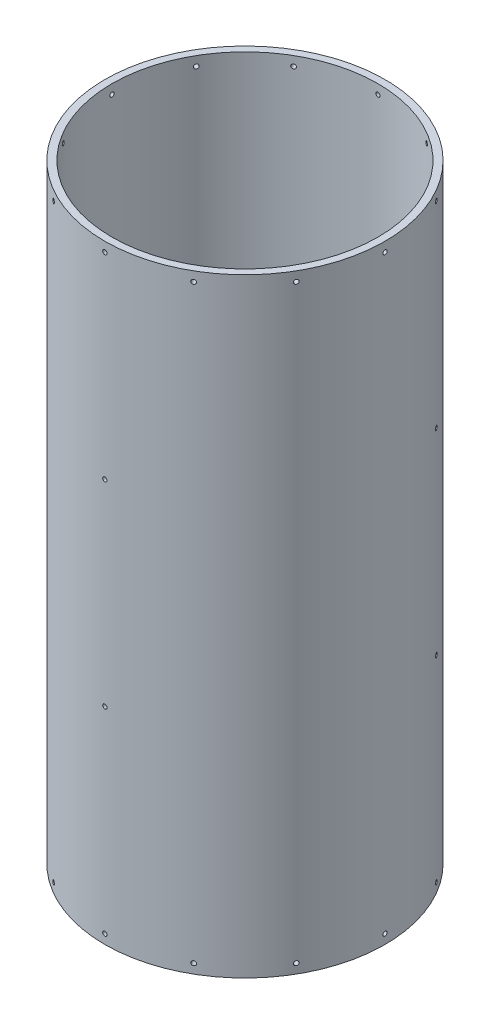
from build123d import *

# Parameters (mm, degrees)
SKETCH1_R                = 93.6625
SKETCH1_R_2              = 88.9
BOSS_EXTRUDE1_DEPTH      = 203.581
SKETCH3_R                = 1.4351
CUT_EXTRUDE1_DEPTH       = 19.304
CIRPATTERN1_COUNT        = 12
MIRROR1_COPY_1_SKETCH_R  = 1.4351
MIRROR1_COPY_1_DEPTH     = 19.304
MIRROR1_COPY_2_SKETCH_R  = 1.4351
MIRROR1_COPY_2_DEPTH     = 19.304
MIRROR1_COPY_3_SKETCH_R  = 1.4351
MIRROR1_COPY_3_DEPTH     = 19.304
MIRROR1_COPY_4_SKETCH_R  = 1.4351
MIRROR1_COPY_4_DEPTH     = 19.304
MIRROR1_COPY_5_SKETCH_R  = 1.4351
MIRROR1_COPY_5_DEPTH     = 19.304
MIRROR1_COPY_6_SKETCH_R  = 1.4351
MIRROR1_COPY_6_DEPTH     = 19.304
MIRROR1_COPY_7_SKETCH_R  = 1.4351
MIRROR1_COPY_7_DEPTH     = 19.304
MIRROR1_COPY_8_SKETCH_R  = 1.4351
MIRROR1_COPY_8_DEPTH     = 19.304
MIRROR1_COPY_9_SKETCH_R  = 1.4351
MIRROR1_COPY_9_DEPTH     = 19.304
MIRROR1_COPY_10_SKETCH_R = 1.4351
MIRROR1_COPY_10_DEPTH    = 19.304
MIRROR1_COPY_11_SKETCH_R = 1.4351
MIRROR1_COPY_11_DEPTH    = 19.304
SKETCH4_R                = 1.4351
CUT_EXTRUDE2_DEPTH       = 43.18
CIRPATTERN2_COUNT        = 3


with BuildPart() as part:
    # Sketch1 → Boss-Extrude1 (new, symmetric)
    with BuildSketch(Plane(origin=(0, 0, 0), x_dir=(1, 0, 0), z_dir=(0, 1, 0))):
        Circle(SKETCH1_R)
        Circle(SKETCH1_R_2, mode=Mode.SUBTRACT)
    extrude(amount=BOSS_EXTRUDE1_DEPTH, both=True)

    # Sketch3 → Cut-Extrude1 (cut)
    with BuildSketch(Plane.XY.offset(93.6625)):
        with Locations((0, -197.231)):
            Circle(SKETCH3_R)
    cut_extrude1 = extrude(amount=-CUT_EXTRUDE1_DEPTH, mode=Mode.SUBTRACT)

    # CirPattern1: Cut-Extrude1 ×12 about axis
    cirpattern1_axis = Axis((0, 203.581, 0), (0, -1, 0))
    for i in range(1, CIRPATTERN1_COUNT):
        add(cut_extrude1.rotate(cirpattern1_axis, i * 360 / CIRPATTERN1_COUNT), mode=Mode.SUBTRACT)

    # Mirror1: Cut-Extrude1 across plane
    add(cut_extrude1.mirror(Plane.ZX), mode=Mode.SUBTRACT)

    # Mirror1 copy 1 sketch → Mirror1 copy 1 (cut)
    with BuildSketch(Plane(origin=(-46.83125, 0, 81.114104382), x_dir=(0.8660254037844387, 0, 0.49999999999999994), z_dir=(-0.49999999999999994, 0, 0.8660254037844387))):
        with Locations((0, 197.231)):
            Circle(MIRROR1_COPY_1_SKETCH_R)
    extrude(amount=-MIRROR1_COPY_1_DEPTH, mode=Mode.SUBTRACT)

    # Mirror1 copy 2 sketch → Mirror1 copy 2 (cut)
    with BuildSketch(Plane(origin=(-81.114104382, 0, 46.83125), x_dir=(0.5000000000000001, 0, 0.8660254037844386), z_dir=(-0.8660254037844386, 0, 0.5000000000000001))):
        with Locations((0, 197.231)):
            Circle(MIRROR1_COPY_2_SKETCH_R)
    extrude(amount=-MIRROR1_COPY_2_DEPTH, mode=Mode.SUBTRACT)

    # Mirror1 copy 3 sketch → Mirror1 copy 3 (cut)
    with BuildSketch(Plane.ZY.offset(93.6625)):
        with Locations((0, 197.231)):
            Circle(MIRROR1_COPY_3_SKETCH_R)
    extrude(amount=-MIRROR1_COPY_3_DEPTH, mode=Mode.SUBTRACT)

    # Mirror1 copy 4 sketch → Mirror1 copy 4 (cut)
    with BuildSketch(Plane(origin=(-81.114104382, 0, -46.83125), x_dir=(-0.4999999999999998, 0, 0.8660254037844387), z_dir=(-0.8660254037844387, 0, -0.4999999999999998))):
        with Locations((0, 197.231)):
            Circle(MIRROR1_COPY_4_SKETCH_R)
    extrude(amount=-MIRROR1_COPY_4_DEPTH, mode=Mode.SUBTRACT)

    # Mirror1 copy 5 sketch → Mirror1 copy 5 (cut)
    with BuildSketch(Plane(origin=(-46.83125, 0, -81.114104382), x_dir=(-0.8660254037844387, 0, 0.49999999999999994), z_dir=(-0.49999999999999994, 0, -0.8660254037844387))):
        with Locations((0, 197.231)):
            Circle(MIRROR1_COPY_5_SKETCH_R)
    extrude(amount=-MIRROR1_COPY_5_DEPTH, mode=Mode.SUBTRACT)

    # Mirror1 copy 6 sketch → Mirror1 copy 6 (cut)
    with BuildSketch(Plane(origin=(0, 0, -93.6625), x_dir=(-1, 0, 0), z_dir=(0, 0, -1))):
        with Locations((0, 197.231)):
            Circle(MIRROR1_COPY_6_SKETCH_R)
    extrude(amount=-MIRROR1_COPY_6_DEPTH, mode=Mode.SUBTRACT)

    # Mirror1 copy 7 sketch → Mirror1 copy 7 (cut)
    with BuildSketch(Plane(origin=(46.83125, 0, -81.114104382), x_dir=(-0.8660254037844386, 0, -0.5000000000000001), z_dir=(0.5000000000000001, 0, -0.8660254037844386))):
        with Locations((0, 197.231)):
            Circle(MIRROR1_COPY_7_SKETCH_R)
    extrude(amount=-MIRROR1_COPY_7_DEPTH, mode=Mode.SUBTRACT)

    # Mirror1 copy 8 sketch → Mirror1 copy 8 (cut)
    with BuildSketch(Plane(origin=(81.114104382, 0, -46.83125), x_dir=(-0.5000000000000004, 0, -0.8660254037844384), z_dir=(0.8660254037844384, 0, -0.5000000000000004))):
        with Locations((0, 197.231)):
            Circle(MIRROR1_COPY_8_SKETCH_R)
    extrude(amount=-MIRROR1_COPY_8_DEPTH, mode=Mode.SUBTRACT)

    # Mirror1 copy 9 sketch → Mirror1 copy 9 (cut)
    with BuildSketch(Plane(origin=(93.6625, 0, 0), x_dir=(0, 0, -1), z_dir=(1, 0, 0))):
        with Locations((0, 197.231)):
            Circle(MIRROR1_COPY_9_SKETCH_R)
    extrude(amount=-MIRROR1_COPY_9_DEPTH, mode=Mode.SUBTRACT)

    # Mirror1 copy 10 sketch → Mirror1 copy 10 (cut)
    with BuildSketch(Plane(origin=(81.114104382, 0, 46.83125), x_dir=(0.5000000000000001, 0, -0.8660254037844386), z_dir=(0.8660254037844386, 0, 0.5000000000000001))):
        with Locations((0, 197.231)):
            Circle(MIRROR1_COPY_10_SKETCH_R)
    extrude(amount=-MIRROR1_COPY_10_DEPTH, mode=Mode.SUBTRACT)

    # Mirror1 copy 11 sketch → Mirror1 copy 11 (cut)
    with BuildSketch(Plane(origin=(46.83125, 0, 81.114104382), x_dir=(0.8660254037844384, 0, -0.5000000000000004), z_dir=(0.5000000000000004, 0, 0.8660254037844384))):
        with Locations((0, 197.231)):
            Circle(MIRROR1_COPY_11_SKETCH_R)
    extrude(amount=-MIRROR1_COPY_11_DEPTH, mode=Mode.SUBTRACT)

    # Sketch4 → Cut-Extrude2 (cut)
    with BuildSketch(Plane.XY.offset(93.6625)):
        with Locations((0, 65.7606)):
            Circle(SKETCH4_R)
        with Locations((0, -65.7606)):
            Circle(SKETCH4_R)
    cut_extrude2 = extrude(amount=-CUT_EXTRUDE2_DEPTH, mode=Mode.SUBTRACT)

    # CirPattern2: Cut-Extrude2 ×3 about axis
    cirpattern2_axis = Axis((0, 203.581, 0), (0, -1, 0))
    for i in range(1, CIRPATTERN2_COUNT):
        add(cut_extrude2.rotate(cirpattern2_axis, i * 360 / CIRPATTERN2_COUNT), mode=Mode.SUBTRACT)


solid = part.part
